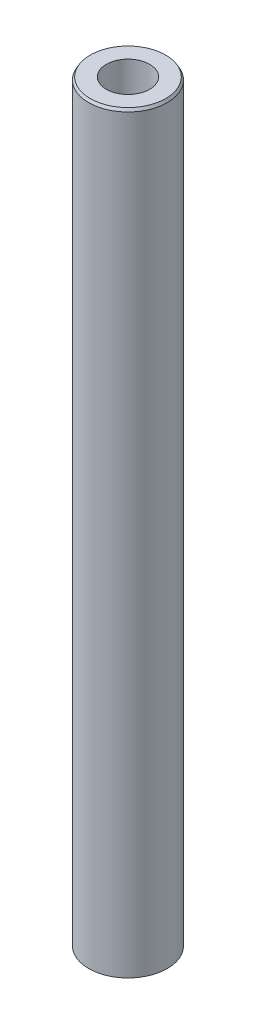
from build123d import *
from OCP.BRepFilletAPI import BRepFilletAPI_MakeChamfer

# Parameters (mm, degrees)
SKETCH1_R           = 7.5
BOSS_EXTRUDE1_DEPTH = 143.953407926
SKETCH2_R           = 4.138969573
CUT_EXTRUDE1_DEPTH  = 145.343630457
CHAMFER1_SIZE       = 0.518977092
CHAMFER1_SIZE2      = 0.299631564


with BuildPart() as part:
    # Sketch1 → Boss-Extrude1 (new body)
    with BuildSketch(Plane(origin=(0, 0, 0), x_dir=(1, 0, 0), z_dir=(0, 1, 0))):
        Circle(SKETCH1_R)
    extrude(amount=BOSS_EXTRUDE1_DEPTH)

    # Sketch2 → Cut-Extrude1 (cut, through all)
    with BuildSketch(Plane(origin=(0, 0, 0), x_dir=(1, 0, 0), z_dir=(0, 1, 0))):
        Circle(SKETCH2_R)
    extrude(amount=CUT_EXTRUDE1_DEPTH, mode=Mode.SUBTRACT)

    # Chamfer1: one chamfer whose edges measure the first distance from different faces: ONE call of the kernel's chamfer builder (chamfer() names one face for all edges)
    chamfer1_edges_1 = [part.edges().sort_by_distance(p)[0] for p in [
        (-7.5, 143.953407926, 0),
    ]]
    chamfer1_side_1 = [part.faces().sort_by_distance(p)[0] for p in [
        (-7.5, 71.976703963, 0),
    ]]
    chamfer1_edges_2 = [part.edges().sort_by_distance(p)[0] for p in [
        (-7.5, 0, 0),
    ]]
    chamfer1_side_2 = [part.faces().sort_by_distance(p)[0] for p in [
        (-7.287867966, 0, 0),
    ]]
    chamfer1 = BRepFilletAPI_MakeChamfer(part.part.solid().wrapped)
    for e in chamfer1_edges_1:
        chamfer1.Add(CHAMFER1_SIZE, CHAMFER1_SIZE2, e.wrapped, chamfer1_side_1[0].wrapped)  # the first distance lies on this face
    for e in chamfer1_edges_2:
        chamfer1.Add(CHAMFER1_SIZE, CHAMFER1_SIZE2, e.wrapped, chamfer1_side_2[0].wrapped)  # the first distance lies on this face
    add(Compound.cast(chamfer1.Shape()), mode=Mode.REPLACE)


solid = part.part
